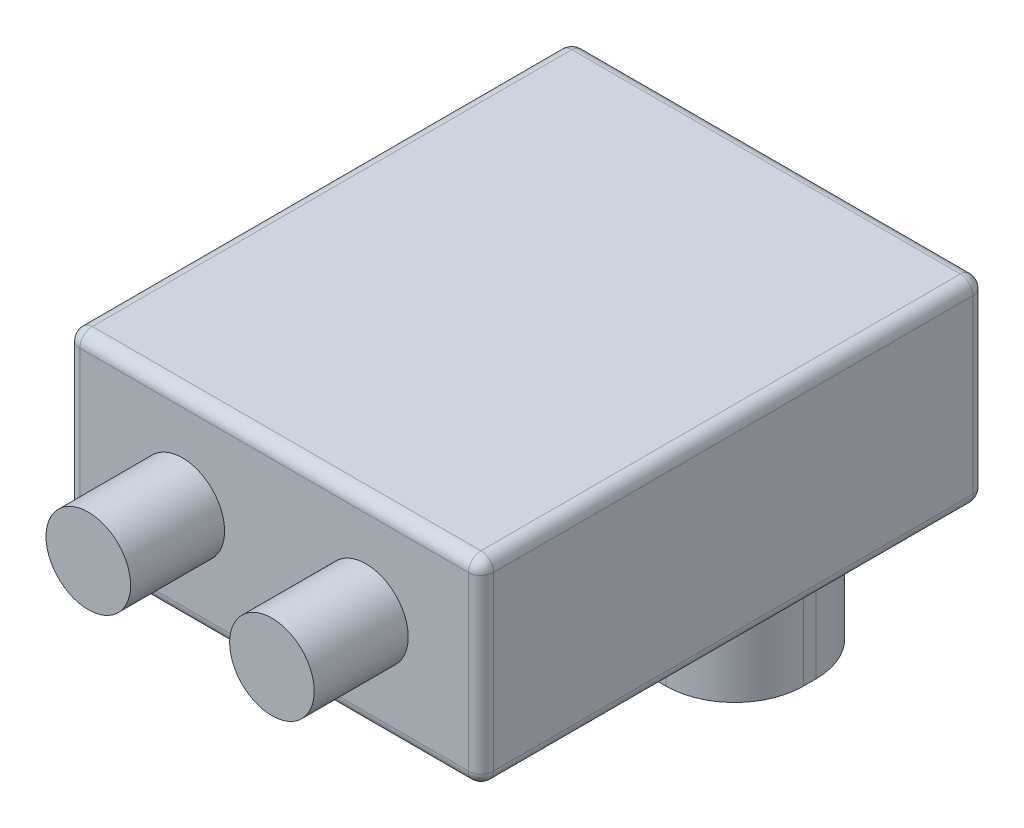
from build123d import *

# Parameters (mm, degrees)
SKETCH1_W           = 66
SKETCH1_H           = 80.5
BOSS_EXTRUDE1_DEPTH = 24.14
SKETCH2_W           = 50
SKETCH2_H           = 24
BOSS_EXTRUDE2_DEPTH = 19
SKETCH3_W           = 66
SKETCH3_H           = 80.5
BOSS_EXTRUDE3_DEPTH = 7.3
FILLET1_R           = 2
FILLET2_R           = 11
SKETCH4_R           = 6.75
BOSS_EXTRUDE4_DEPTH = 15


with BuildPart() as part:
    # Sketch1 → Boss-Extrude1 (new body)
    with BuildSketch(Plane(origin=(0, 0, 0), x_dir=(1, 0, 0), z_dir=(0, 1, 0))):
        Rectangle(SKETCH1_W, SKETCH1_H)
    extrude(amount=BOSS_EXTRUDE1_DEPTH)

    # Sketch2 → Boss-Extrude2 (add)
    with BuildSketch(Plane.XZ):
        with Locations((0, -20.25)):
            Rectangle(SKETCH2_W, SKETCH2_H)
    extrude(amount=BOSS_EXTRUDE2_DEPTH)

    # Sketch3 → Boss-Extrude3 (add)
    with BuildSketch(Plane(origin=(0, 24.14, 0), x_dir=(1, 0, 0), z_dir=(0, 1, 0))):
        Rectangle(SKETCH3_W, SKETCH3_H)
    extrude(amount=BOSS_EXTRUDE3_DEPTH)

    # Fillet1
    fillet1_edges = [part.edges().sort_by_distance(p)[0] for p in [
        (0, 0, -40.25),
        (0, 0, 40.25),
        (-33, 15.72, -40.25),
        (-33, 15.72, 40.25),
        (-33, 0, 0),
        (33, 15.72, 40.25),
        (33, 15.72, -40.25),
        (33, 0, 0),
        (0, 31.44, -40.25),
        (0, 31.44, 40.25),
        (-33, 31.44, 0),
        (33, 31.44, 0),
    ]]
    fillet(fillet1_edges, radius=FILLET1_R)

    # Fillet2
    fillet2_edges = [part.edges().sort_by_distance(p)[0] for p in [
        (25, -9.5, -8.25),
        (25, -9.5, -32.25),
        (-25, -9.5, -32.25),
        (-25, -9.5, -8.25),
    ]]
    fillet(fillet2_edges, radius=FILLET2_R)

    # Sketch4 → Boss-Extrude4 (add)
    with BuildSketch(Plane.XY.offset(40.25)):
        with Locations((-14.64999991, 15.7200005)):
            Circle(SKETCH4_R)
        with Locations((14.64999991, 15.7200005)):
            Circle(SKETCH4_R)
    extrude(amount=BOSS_EXTRUDE4_DEPTH)


solid = part.part
